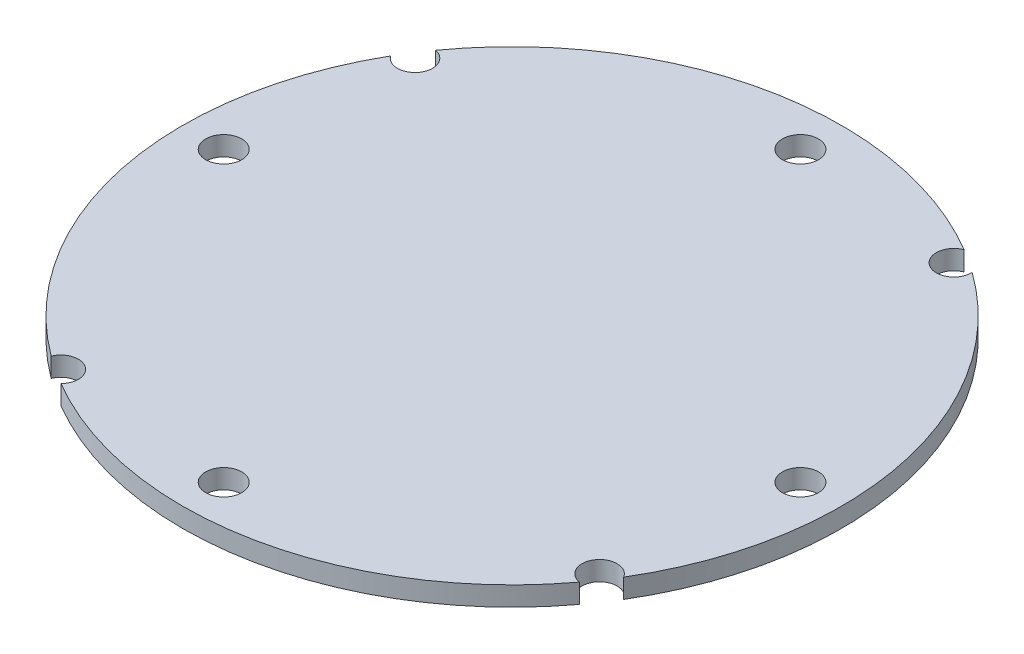
from build123d import *

# Parameters (mm, degrees)
SKETCH1_R                    = 63.9
BOSS_EXTRUDE1_DEPTH          = 3.75
M6_CLEARANCE_HOLE1_D         = 7
CIRPATTERN1_COUNT            = 4
TAP_DRILL_FOR_M8X1_25_TAP2_D = 6.8


with BuildPart() as part:
    # Sketch1 → Boss-Extrude1 (new body)
    with BuildSketch(Plane(origin=(0, 0, 0), x_dir=(1, 0, 0), z_dir=(0, 1, 0))):
        Circle(SKETCH1_R)
    extrude(amount=BOSS_EXTRUDE1_DEPTH)

    # M6 Clearance Hole1 (through all)
    with Locations(Plane(origin=(0, 3.75, 0), x_dir=(1, 0, 0), z_dir=(0, 1, 0))):
        with Locations((-55.9, 0)):
            m6_clearance_hole1 = Hole(M6_CLEARANCE_HOLE1_D / 2)

    # CirPattern1: M6 Clearance Hole1 ×4 about axis
    cirpattern1_axis = Axis((0, 3.75, 0), (0, -1, 0))
    for i in range(1, CIRPATTERN1_COUNT):
        add(m6_clearance_hole1.rotate(cirpattern1_axis, i * 360 / CIRPATTERN1_COUNT), mode=Mode.SUBTRACT)

    # Tap Drill for M8x1.25 Tap2 (through all)
    with Locations(Plane(origin=(-34.760459989, 0, 52.725568888), x_dir=(0, 0, -1), z_dir=(0, -1, 0))):
        with Locations((0, 0), (17.888672707, 86.559201641), (104.447874348, 68.670528934), (86.559201641, -17.888672707)):
            Hole(TAP_DRILL_FOR_M8X1_25_TAP2_D / 2)


solid = part.part
